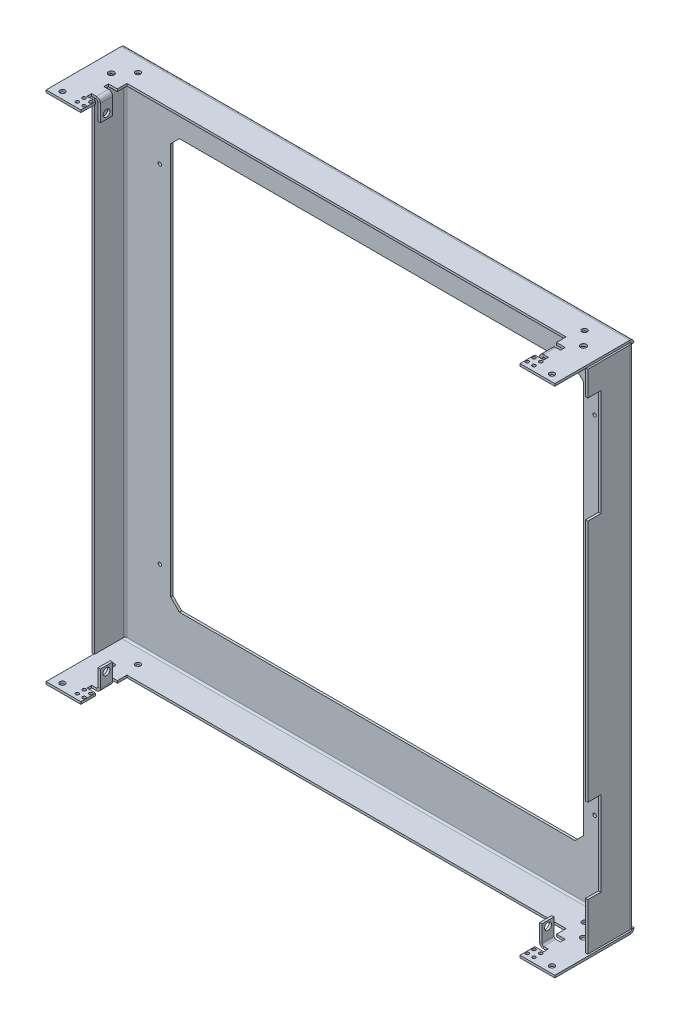
from build123d import *

# Parameters (mm, degrees)
SKETCH1_W                    = 585
SKETCH1_H                    = 592
BASE_FLANGE1_DEPTH           = 2.7
CUT_EXTRUDE1_REACH           = 834.284
CUT_EXTRUDE2_REACH           = 834.284
SKETCH7_R                    = 2
EDGE_FLANGE1_STRIP_W         = 14.8
EDGE_FLANGE1_STRIP_H         = 2.7
EDGE_FLANGE1_STRIP_CUT_DEPTH = 585
EDGE_FLANGE1_DEPTH           = 585
CUT_EXTRUDE3_REACH           = 838.95
SKETCH12_W                   = 505
SKETCH12_H                   = 53
CUT_EXTRUDE4_REACH           = 838.95
SKETCH13_R                   = 1.9
SKETCH13_R_2                 = 3
SKETCH13_R_3                 = 3.295
SKETCH13_W                   = 5
SKETCH13_H                   = 2.6
EDGE_FLANGE2_START           = 46.4
EDGE_FLANGE2_OUTLINE_W       = 10.1
EDGE_FLANGE2_OUTLINE_H       = 2.7
EDGE_FLANGE2_DEPTH           = 5.4
EDGE_FLANGE2_START_2         = 65.8
EDGE_FLANGE2_2_OUTLINE_W     = 10.1
EDGE_FLANGE2_2_OUTLINE_H     = 2.7
EDGE_FLANGE2_2_DEPTH         = 5.4
EDGE_FLANGE2_START_3         = 51.8
EDGE_FLANGE2_3_DEPTH         = 14
EDGE_FLANGE2_4_DEPTH         = 14
EDGE_FLANGE3_START           = 46.4
EDGE_FLANGE3_OUTLINE_W       = 10.1
EDGE_FLANGE3_OUTLINE_H       = 2.7
EDGE_FLANGE3_DEPTH           = 5.4
EDGE_FLANGE3_START_2         = 65.8
EDGE_FLANGE3_2_OUTLINE_W     = 10.1
EDGE_FLANGE3_2_OUTLINE_H     = 2.7
EDGE_FLANGE3_2_DEPTH         = 5.4
EDGE_FLANGE3_START_3         = 51.8
EDGE_FLANGE3_3_DEPTH         = 14
EDGE_FLANGE3_4_DEPTH         = 14
SKETCH18_R                   = 4
CUT_EXTRUDE6_DEPTH           = 810.497306975
EDGE_FLANGE4_START           = 46.4
EDGE_FLANGE4_OUTLINE_W       = 10.1
EDGE_FLANGE4_OUTLINE_H       = 2.7
EDGE_FLANGE4_DEPTH           = 5.4
EDGE_FLANGE4_START_2         = 65.8
EDGE_FLANGE4_2_OUTLINE_W     = 10.1
EDGE_FLANGE4_2_OUTLINE_H     = 2.7
EDGE_FLANGE4_2_DEPTH         = 5.4
EDGE_FLANGE4_START_3         = 51.8
EDGE_FLANGE4_3_DEPTH         = 14
EDGE_FLANGE4_4_DEPTH         = 14
CUT_EXTRUDE7_REACH           = 811.497
SKETCH25_R                   = 4
EDGE_FLANGE5_STRIP_W         = 14.8
EDGE_FLANGE5_STRIP_H         = 2.7
EDGE_FLANGE5_STRIP_CUT_DEPTH = 582.6
EDGE_FLANGE5_DEPTH           = 582.6
EDGE_FLANGE6_STRIP_W         = 14.8
EDGE_FLANGE6_STRIP_H         = 2.7
EDGE_FLANGE6_STRIP_CUT_DEPTH = 582.6
EDGE_FLANGE6_DEPTH           = 582.6
CUT_EXTRUDE8_REACH           = 838.95
SKETCH37_W                   = 15
SKETCH37_H                   = 122.57172438
SKETCH37_H_2                 = 97.043961851


# Read off the part's stored shape, not the designer's step: Edge-Flange2, Edge-Flange3, Edge-Flange4
# Sheet-metal steps are written as plain solids
with BuildPart() as part:
    # Sketch1 → Base-Flange1 (new body)
    with BuildSketch(Plane.XY):
        with Locations((292.5, 296)):
            Rectangle(SKETCH1_W, SKETCH1_H)
    extrude(amount=-BASE_FLANGE1_DEPTH)

    # Sketch6 → Cut-Extrude1 (cut, up to next)
    with BuildSketch(Plane.XY, mode=Mode.PRIVATE) as cut_extrude1_sk1:
        Polygon((520, 531.8), (65, 531.8), (55, 521.8), (55, 70.2), (65, 60.2), (520, 60.2), (530, 70.2), (530, 521.8), align=None)
    cut_extrude1_tool1 = extrude(cut_extrude1_sk1.sketch, amount=-CUT_EXTRUDE1_REACH, mode=Mode.PRIVATE) & part.part
    add(cut_extrude1_tool1.solids().sort_by_distance((292.5, 296, 0))[0], mode=Mode.SUBTRACT)

    # Sketch7 → Cut-Extrude2 (cut, up to next)
    with BuildSketch(Plane.XY, mode=Mode.PRIVATE) as cut_extrude2_sk1:
        with Locations((42.5, 495.3)):
            Circle(SKETCH7_R)
    cut_extrude2_tool1 = extrude(cut_extrude2_sk1.sketch, amount=-CUT_EXTRUDE2_REACH, mode=Mode.PRIVATE) & part.part
    # Sketch7 → Cut-Extrude2 (cut, up to next)
    with BuildSketch(Plane.XY, mode=Mode.PRIVATE) as cut_extrude2_sk2:
        with Locations((542.5, 495.3)):
            Circle(SKETCH7_R)
    cut_extrude2_tool2 = extrude(cut_extrude2_sk2.sketch, amount=-CUT_EXTRUDE2_REACH, mode=Mode.PRIVATE) & part.part
    # Sketch7 → Cut-Extrude2 (cut, up to next)
    with BuildSketch(Plane.XY, mode=Mode.PRIVATE) as cut_extrude2_sk3:
        with Locations((42.5, 96.7)):
            Circle(SKETCH7_R)
    cut_extrude2_tool3 = extrude(cut_extrude2_sk3.sketch, amount=-CUT_EXTRUDE2_REACH, mode=Mode.PRIVATE) & part.part
    # Sketch7 → Cut-Extrude2 (cut, up to next)
    with BuildSketch(Plane.XY, mode=Mode.PRIVATE) as cut_extrude2_sk4:
        with Locations((542.5, 96.7)):
            Circle(SKETCH7_R)
    cut_extrude2_tool4 = extrude(cut_extrude2_sk4.sketch, amount=-CUT_EXTRUDE2_REACH, mode=Mode.PRIVATE) & part.part
    add(cut_extrude2_tool1.solids().sort_by_distance((42.5, 495.3, 0))[0], mode=Mode.SUBTRACT)
    add(cut_extrude2_tool2.solids().sort_by_distance((542.5, 495.3, 0))[0], mode=Mode.SUBTRACT)
    add(cut_extrude2_tool3.solids().sort_by_distance((42.5, 96.7, 0))[0], mode=Mode.SUBTRACT)
    add(cut_extrude2_tool4.solids().sort_by_distance((542.5, 96.7, 0))[0], mode=Mode.SUBTRACT)

    # Edge-Flange1 strip (across the edge) → Edge-Flange1 strip cut (cut)
    with BuildSketch(Plane.YZ):
        with Locations((-2.7, -1.35)):
            Rectangle(EDGE_FLANGE1_STRIP_W, EDGE_FLANGE1_STRIP_H)
    edge_flange1_strip_cut = extrude(amount=EDGE_FLANGE1_STRIP_CUT_DEPTH, mode=Mode.SUBTRACT)

    # Edge-Flange1 section (across the edge) → Edge-Flange1 (add)
    with BuildSketch(Plane.YZ):
        with BuildLine():
            Line((0, 2), (0, 88.3))
            Line((0, 88.3), (2.7, 88.3))
            Line((2.7, 88.3), (2.7, 2))
            ThreePointArc((2.7, 2), (3.285786438, 0.585786438), (4.7, 0))
            Line((4.7, 0), (4.7, -2.7))
            ThreePointArc((4.7, -2.7), (1.376598128, -1.323401872), (0, 2))
        make_face()
    edge_flange1 = extrude(amount=EDGE_FLANGE1_DEPTH)

    # Sketch12 → Cut-Extrude3 (cut, up to next)
    with BuildSketch(Plane.XZ, mode=Mode.PRIVATE) as cut_extrude3_sk1:
        with Locations((292.5, 61.8)):
            Rectangle(SKETCH12_W, SKETCH12_H)
    cut_extrude3_tool1 = extrude(cut_extrude3_sk1.sketch, amount=-CUT_EXTRUDE3_REACH, mode=Mode.PRIVATE) & part.part
    cut_extrude3 = cut_extrude3_tool1.solids().sort_by_distance((292.5, 0, 61.8))[0]
    add(cut_extrude3, mode=Mode.SUBTRACT)

    # Sketch13 → Cut-Extrude4 (cut, up to next)
    with BuildSketch(Plane.XZ, mode=Mode.PRIVATE) as cut_extrude4_sk1:
        with Locations(Location((555.05, 74.5, 0), (0, 0, 270))):
            Circle(SKETCH13_R)
    cut_extrude4_tool1 = extrude(cut_extrude4_sk1.sketch, amount=-CUT_EXTRUDE4_REACH, mode=Mode.PRIVATE) & part.part
    # Sketch13 → Cut-Extrude4 (cut, up to next)
    with BuildSketch(Plane.XZ, mode=Mode.PRIVATE) as cut_extrude4_sk2:
        with Locations(Location((547.25, 74.5, 0), (0, 0, 270))):
            Circle(SKETCH13_R)
    cut_extrude4_tool2 = extrude(cut_extrude4_sk2.sketch, amount=-CUT_EXTRUDE4_REACH, mode=Mode.PRIVATE) & part.part
    # Sketch13 → Cut-Extrude4 (cut, up to next)
    with BuildSketch(Plane.XZ, mode=Mode.PRIVATE) as cut_extrude4_sk3:
        with Locations(Location((555.05, 82.3, 0), (0, 0, 270))):
            Circle(SKETCH13_R)
    cut_extrude4_tool3 = extrude(cut_extrude4_sk3.sketch, amount=-CUT_EXTRUDE4_REACH, mode=Mode.PRIVATE) & part.part
    # Sketch13 → Cut-Extrude4 (cut, up to next)
    with BuildSketch(Plane.XZ, mode=Mode.PRIVATE) as cut_extrude4_sk4:
        with Locations(Location((547.25, 82.3, 0), (0, 0, 270))):
            Circle(SKETCH13_R)
    cut_extrude4_tool4 = extrude(cut_extrude4_sk4.sketch, amount=-CUT_EXTRUDE4_REACH, mode=Mode.PRIVATE) & part.part
    # Sketch13 → Cut-Extrude4 (cut, up to next)
    with BuildSketch(Plane.XZ, mode=Mode.PRIVATE) as cut_extrude4_sk5:
        with Locations(Location((574, 80.5, 0), (0, 0, 270))):
            Circle(SKETCH13_R_2)
    cut_extrude4_tool5 = extrude(cut_extrude4_sk5.sketch, amount=-CUT_EXTRUDE4_REACH, mode=Mode.PRIVATE) & part.part
    # Sketch13 → Cut-Extrude4 (cut, up to next)
    with BuildSketch(Plane.XZ, mode=Mode.PRIVATE) as cut_extrude4_sk6:
        with Locations(Location((564, 34.3, 0), (0, 0, 270))):
            Circle(SKETCH13_R_3)
    cut_extrude4_tool6 = extrude(cut_extrude4_sk6.sketch, amount=-CUT_EXTRUDE4_REACH, mode=Mode.PRIVATE) & part.part
    # Sketch13 → Cut-Extrude4 (cut, up to next)
    with BuildSketch(Plane.XZ, mode=Mode.PRIVATE) as cut_extrude4_sk7:
        with Locations(Location((549.3, 18.3, 0), (0, 0, 270))):
            Circle(SKETCH13_R_2)
    cut_extrude4_tool7 = extrude(cut_extrude4_sk7.sketch, amount=-CUT_EXTRUDE4_REACH, mode=Mode.PRIVATE) & part.part
    # Sketch13 → Cut-Extrude4 (cut, up to next)
    with BuildSketch(Plane.XZ, mode=Mode.PRIVATE) as cut_extrude4_sk8:
        with Locations(Location((35.7, 18.3, 0), (0, 0, 90))):
            Circle(SKETCH13_R_2)
    cut_extrude4_tool8 = extrude(cut_extrude4_sk8.sketch, amount=-CUT_EXTRUDE4_REACH, mode=Mode.PRIVATE) & part.part
    # Sketch13 → Cut-Extrude4 (cut, up to next)
    with BuildSketch(Plane.XZ, mode=Mode.PRIVATE) as cut_extrude4_sk9:
        with Locations(Location((21, 34.3, 0), (0, 0, 90))):
            Circle(SKETCH13_R_3)
    cut_extrude4_tool9 = extrude(cut_extrude4_sk9.sketch, amount=-CUT_EXTRUDE4_REACH, mode=Mode.PRIVATE) & part.part
    # Sketch13 → Cut-Extrude4 (cut, up to next)
    with BuildSketch(Plane.XZ, mode=Mode.PRIVATE) as cut_extrude4_sk10:
        with Locations(Location((11, 80.5, 0), (0, 0, 90))):
            Circle(SKETCH13_R_2)
    cut_extrude4_tool10 = extrude(cut_extrude4_sk10.sketch, amount=-CUT_EXTRUDE4_REACH, mode=Mode.PRIVATE) & part.part
    # Sketch13 → Cut-Extrude4 (cut, up to next)
    with BuildSketch(Plane.XZ, mode=Mode.PRIVATE) as cut_extrude4_sk11:
        with Locations(Location((37.75, 82.3, 0), (0, 0, 90))):
            Circle(SKETCH13_R)
    cut_extrude4_tool11 = extrude(cut_extrude4_sk11.sketch, amount=-CUT_EXTRUDE4_REACH, mode=Mode.PRIVATE) & part.part
    # Sketch13 → Cut-Extrude4 (cut, up to next)
    with BuildSketch(Plane.XZ, mode=Mode.PRIVATE) as cut_extrude4_sk12:
        with Locations(Location((29.95, 82.3, 0), (0, 0, 90))):
            Circle(SKETCH13_R)
    cut_extrude4_tool12 = extrude(cut_extrude4_sk12.sketch, amount=-CUT_EXTRUDE4_REACH, mode=Mode.PRIVATE) & part.part
    # Sketch13 → Cut-Extrude4 (cut, up to next)
    with BuildSketch(Plane.XZ, mode=Mode.PRIVATE) as cut_extrude4_sk13:
        with Locations(Location((37.75, 74.5, 0), (0, 0, 90))):
            Circle(SKETCH13_R)
    cut_extrude4_tool13 = extrude(cut_extrude4_sk13.sketch, amount=-CUT_EXTRUDE4_REACH, mode=Mode.PRIVATE) & part.part
    # Sketch13 → Cut-Extrude4 (cut, up to next)
    with BuildSketch(Plane.XZ, mode=Mode.PRIVATE) as cut_extrude4_sk14:
        with Locations(Location((29.95, 74.5, 0), (0, 0, 90))):
            Circle(SKETCH13_R)
    cut_extrude4_tool14 = extrude(cut_extrude4_sk14.sketch, amount=-CUT_EXTRUDE4_REACH, mode=Mode.PRIVATE) & part.part
    # Sketch13 → Cut-Extrude4 (cut, up to next)
    with BuildSketch(Plane.XZ, mode=Mode.PRIVATE) as cut_extrude4_sk15:
        with Locations((547.5, 50.5)):
            Rectangle(SKETCH13_W, SKETCH13_H)
    cut_extrude4_tool15 = extrude(cut_extrude4_sk15.sketch, amount=-CUT_EXTRUDE4_REACH, mode=Mode.PRIVATE) & part.part
    # Sketch13 → Cut-Extrude4 (cut, up to next)
    with BuildSketch(Plane.XZ, mode=Mode.PRIVATE) as cut_extrude4_sk16:
        with Locations((547.5, 67.1)):
            Rectangle(SKETCH13_W, SKETCH13_H)
    cut_extrude4_tool16 = extrude(cut_extrude4_sk16.sketch, amount=-CUT_EXTRUDE4_REACH, mode=Mode.PRIVATE) & part.part
    # Sketch13 → Cut-Extrude4 (cut, up to next)
    with BuildSketch(Plane.XZ, mode=Mode.PRIVATE) as cut_extrude4_sk17:
        with Locations((37.5, 50.5)):
            Rectangle(SKETCH13_W, SKETCH13_H)
    cut_extrude4_tool17 = extrude(cut_extrude4_sk17.sketch, amount=-CUT_EXTRUDE4_REACH, mode=Mode.PRIVATE) & part.part
    # Sketch13 → Cut-Extrude4 (cut, up to next)
    with BuildSketch(Plane.XZ, mode=Mode.PRIVATE) as cut_extrude4_sk18:
        with Locations((37.5, 67.1)):
            Rectangle(SKETCH13_W, SKETCH13_H)
    cut_extrude4_tool18 = extrude(cut_extrude4_sk18.sketch, amount=-CUT_EXTRUDE4_REACH, mode=Mode.PRIVATE) & part.part
    cut_extrude4_1 = cut_extrude4_tool1.solids().sort_by_distance((555.05, 0, 74.5))[0]
    add(cut_extrude4_1, mode=Mode.SUBTRACT)
    cut_extrude4_2 = cut_extrude4_tool2.solids().sort_by_distance((547.25, 0, 74.5))[0]
    add(cut_extrude4_2, mode=Mode.SUBTRACT)
    cut_extrude4_3 = cut_extrude4_tool3.solids().sort_by_distance((555.05, 0, 82.3))[0]
    add(cut_extrude4_3, mode=Mode.SUBTRACT)
    cut_extrude4_4 = cut_extrude4_tool4.solids().sort_by_distance((547.25, 0, 82.3))[0]
    add(cut_extrude4_4, mode=Mode.SUBTRACT)
    cut_extrude4_5 = cut_extrude4_tool5.solids().sort_by_distance((574, 0, 80.5))[0]
    add(cut_extrude4_5, mode=Mode.SUBTRACT)
    cut_extrude4_6 = cut_extrude4_tool6.solids().sort_by_distance((564, 0, 34.3))[0]
    add(cut_extrude4_6, mode=Mode.SUBTRACT)
    cut_extrude4_7 = cut_extrude4_tool7.solids().sort_by_distance((549.3, 0, 18.3))[0]
    add(cut_extrude4_7, mode=Mode.SUBTRACT)
    cut_extrude4_8 = cut_extrude4_tool8.solids().sort_by_distance((35.7, 0, 18.3))[0]
    add(cut_extrude4_8, mode=Mode.SUBTRACT)
    cut_extrude4_9 = cut_extrude4_tool9.solids().sort_by_distance((21, 0, 34.3))[0]
    add(cut_extrude4_9, mode=Mode.SUBTRACT)
    cut_extrude4_10 = cut_extrude4_tool10.solids().sort_by_distance((11, 0, 80.5))[0]
    add(cut_extrude4_10, mode=Mode.SUBTRACT)
    cut_extrude4_11 = cut_extrude4_tool11.solids().sort_by_distance((37.75, 0, 82.3))[0]
    add(cut_extrude4_11, mode=Mode.SUBTRACT)
    cut_extrude4_12 = cut_extrude4_tool12.solids().sort_by_distance((29.95, 0, 82.3))[0]
    add(cut_extrude4_12, mode=Mode.SUBTRACT)
    cut_extrude4_13 = cut_extrude4_tool13.solids().sort_by_distance((37.75, 0, 74.5))[0]
    add(cut_extrude4_13, mode=Mode.SUBTRACT)
    cut_extrude4_14 = cut_extrude4_tool14.solids().sort_by_distance((29.95, 0, 74.5))[0]
    add(cut_extrude4_14, mode=Mode.SUBTRACT)
    cut_extrude4_15 = cut_extrude4_tool15.solids().sort_by_distance((547.5, 0, 50.5))[0]
    add(cut_extrude4_15, mode=Mode.SUBTRACT)
    cut_extrude4_16 = cut_extrude4_tool16.solids().sort_by_distance((547.5, 0, 67.1))[0]
    add(cut_extrude4_16, mode=Mode.SUBTRACT)
    cut_extrude4_17 = cut_extrude4_tool17.solids().sort_by_distance((37.5, 0, 50.5))[0]
    add(cut_extrude4_17, mode=Mode.SUBTRACT)
    cut_extrude4_18 = cut_extrude4_tool18.solids().sort_by_distance((37.5, 0, 67.1))[0]
    add(cut_extrude4_18, mode=Mode.SUBTRACT)
    cut_extrude4 = cut_extrude4_1 + cut_extrude4_2 + cut_extrude4_3 + cut_extrude4_4 + cut_extrude4_5 + cut_extrude4_6 + cut_extrude4_7 + cut_extrude4_8 + cut_extrude4_9 + cut_extrude4_10 + cut_extrude4_11 + cut_extrude4_12 + cut_extrude4_13 + cut_extrude4_14 + cut_extrude4_15 + cut_extrude4_16 + cut_extrude4_17 + cut_extrude4_18  # Cut-Extrude4 as one shape, for the pattern or mirror that repeats it

    # Edge-Flange2 outline → Edge-Flange2 (cut)
    with BuildSketch(Plane.XY.offset(EDGE_FLANGE2_START)):
        with Locations((550.05, 1.35)):
            Rectangle(EDGE_FLANGE2_OUTLINE_W, EDGE_FLANGE2_OUTLINE_H)
    extrude(amount=EDGE_FLANGE2_DEPTH, mode=Mode.SUBTRACT)

    # Edge-Flange2 2 outline → Edge-Flange2 2 (cut)
    with BuildSketch(Plane.XY.offset(EDGE_FLANGE2_START_2)):
        with Locations((550.05, 1.35)):
            Rectangle(EDGE_FLANGE2_2_OUTLINE_W, EDGE_FLANGE2_2_OUTLINE_H)
    extrude(amount=EDGE_FLANGE2_2_DEPTH, mode=Mode.SUBTRACT)

    # Edge-Flange2 3 outline → Edge-Flange2 3 (cut)
    with BuildSketch(Plane.XY.offset(EDGE_FLANGE2_START_3)):
        with BuildLine():
            ThreePointArc((549.7, 0), (547.181071656, 0.732003024), (545.446765936, 2.7))
            Line((545.446765936, 2.7), (545, 2.7))
            Line((545, 2.7), (545, 0))
            Line((545, 0), (549.7, 0))
        make_face()
    extrude(amount=EDGE_FLANGE2_3_DEPTH, mode=Mode.SUBTRACT)

    # Edge-Flange2 4 outline → Edge-Flange2 4 (add)
    with BuildSketch(Plane.XY.offset(EDGE_FLANGE2_START_3)):
        with BuildLine():
            Line((547.7, 24), (545, 24))
            Line((545, 24), (545, 4.7))
            ThreePointArc((545, 4.7), (545.113051117, 3.675353744), (545.446765936, 2.7))
            Line((545.446765936, 2.7), (549.7, 2.7))
            ThreePointArc((549.7, 2.7), (548.285786438, 3.285786438), (547.7, 4.7))
            Line((547.7, 4.7), (547.7, 24))
        make_face()
    extrude(amount=EDGE_FLANGE2_4_DEPTH)

    # Edge-Flange3 outline → Edge-Flange3 (cut)
    with BuildSketch(Plane.XY.offset(EDGE_FLANGE3_START)):
        with Locations((34.95, 1.35)):
            Rectangle(EDGE_FLANGE3_OUTLINE_W, EDGE_FLANGE3_OUTLINE_H)
    edge_flange3 = extrude(amount=EDGE_FLANGE3_DEPTH, mode=Mode.SUBTRACT)

    # Edge-Flange3 2 outline → Edge-Flange3 2 (cut)
    with BuildSketch(Plane.XY.offset(EDGE_FLANGE3_START_2)):
        with Locations((34.95, 1.35)):
            Rectangle(EDGE_FLANGE3_2_OUTLINE_W, EDGE_FLANGE3_2_OUTLINE_H)
    edge_flange3_2 = extrude(amount=EDGE_FLANGE3_2_DEPTH, mode=Mode.SUBTRACT)

    # Edge-Flange3 3 outline → Edge-Flange3 3 (cut)
    with BuildSketch(Plane.XY.offset(EDGE_FLANGE3_START_3)):
        with BuildLine():
            Line((40, 2.7), (39.553234064, 2.7))
            ThreePointArc((39.553234064, 2.7), (37.818928344, 0.732003024), (35.3, 0))
            Line((35.3, 0), (40, 0))
            Line((40, 0), (40, 2.7))
        make_face()
    edge_flange3_3 = extrude(amount=EDGE_FLANGE3_3_DEPTH, mode=Mode.SUBTRACT)

    # Edge-Flange3 4 outline → Edge-Flange3 4 (add)
    with BuildSketch(Plane.XY.offset(EDGE_FLANGE3_START_3)):
        with BuildLine():
            Line((40, 4.7), (40, 24))
            Line((40, 24), (37.3, 24))
            Line((37.3, 24), (37.3, 4.7))
            ThreePointArc((37.3, 4.7), (36.714213562, 3.285786438), (35.3, 2.7))
            Line((35.3, 2.7), (39.553234064, 2.7))
            ThreePointArc((39.553234064, 2.7), (39.886948883, 3.675353744), (40, 4.7))
        make_face()
    edge_flange3_4 = extrude(amount=EDGE_FLANGE3_4_DEPTH)

    # Sketch18 → Cut-Extrude6 (cut, symmetric)
    with BuildSketch(Plane.ZY.offset(-545)):
        with Locations(Location((58.8, 18, 0), (0, 0, 270))):
            Circle(SKETCH18_R)
    cut_extrude6 = extrude(amount=CUT_EXTRUDE6_DEPTH, both=True, mode=Mode.SUBTRACT)

    # Mirror1: Edge-Flange1 strip cut, Edge-Flange1, Cut-Extrude3, Cut-Extrude4, Edge-Flange3, Edge-Flange3 2, Edge-Flange3 3, Edge-Flange3 4, Cut-Extrude6 across plane
    add(edge_flange1_strip_cut.mirror(Plane.ZX.offset(296)), mode=Mode.SUBTRACT)
    add(edge_flange1.mirror(Plane.ZX.offset(296)))
    add(cut_extrude3.mirror(Plane.ZX.offset(296)), mode=Mode.SUBTRACT)
    add(cut_extrude4.mirror(Plane.ZX.offset(296)), mode=Mode.SUBTRACT)
    add(edge_flange3.mirror(Plane.ZX.offset(296)), mode=Mode.SUBTRACT)
    add(edge_flange3_2.mirror(Plane.ZX.offset(296)), mode=Mode.SUBTRACT)
    add(edge_flange3_3.mirror(Plane.ZX.offset(296)), mode=Mode.SUBTRACT)
    add(edge_flange3_4.mirror(Plane.ZX.offset(296)))
    add(cut_extrude6.mirror(Plane.ZX.offset(296)), mode=Mode.SUBTRACT)

    # Edge-Flange4 outline → Edge-Flange4 (cut)
    with BuildSketch(Plane.XY.offset(EDGE_FLANGE4_START)):
        with Locations((550.05, 590.65)):
            Rectangle(EDGE_FLANGE4_OUTLINE_W, EDGE_FLANGE4_OUTLINE_H)
    extrude(amount=EDGE_FLANGE4_DEPTH, mode=Mode.SUBTRACT)

    # Edge-Flange4 2 outline → Edge-Flange4 2 (cut)
    with BuildSketch(Plane.XY.offset(EDGE_FLANGE4_START_2)):
        with Locations((550.05, 590.65)):
            Rectangle(EDGE_FLANGE4_2_OUTLINE_W, EDGE_FLANGE4_2_OUTLINE_H)
    extrude(amount=EDGE_FLANGE4_2_DEPTH, mode=Mode.SUBTRACT)

    # Edge-Flange4 3 outline → Edge-Flange4 3 (cut)
    with BuildSketch(Plane.XY.offset(EDGE_FLANGE4_START_3)):
        with BuildLine():
            Line((545, 589.3), (545.446765936, 589.3))
            ThreePointArc((545.446765936, 589.3), (547.181071656, 591.267996976), (549.7, 592))
            Line((549.7, 592), (545, 592))
            Line((545, 592), (545, 589.3))
        make_face()
    extrude(amount=EDGE_FLANGE4_3_DEPTH, mode=Mode.SUBTRACT)

    # Edge-Flange4 4 outline → Edge-Flange4 4 (add)
    with BuildSketch(Plane.XY.offset(EDGE_FLANGE4_START_3)):
        with BuildLine():
            ThreePointArc((545.446765936, 589.3), (545.113051117, 588.324646256), (545, 587.3))
            Line((545, 587.3), (545, 568))
            Line((545, 568), (547.7, 568))
            Line((547.7, 568), (547.7, 587.3))
            ThreePointArc((547.7, 587.3), (548.285786438, 588.714213562), (549.7, 589.3))
            Line((549.7, 589.3), (545.446765936, 589.3))
        make_face()
    extrude(amount=EDGE_FLANGE4_4_DEPTH)

    # Sketch25 → Cut-Extrude7 (cut, up to next)
    with BuildSketch(Plane.ZY.offset(-545), mode=Mode.PRIVATE) as cut_extrude7_sk1:
        with Locations(Location((58.8, 574, 0), (0, 0, 270))):
            Circle(SKETCH25_R)
    cut_extrude7_tool1 = extrude(cut_extrude7_sk1.sketch, amount=-CUT_EXTRUDE7_REACH, mode=Mode.PRIVATE) & part.part
    add(cut_extrude7_tool1.solids().sort_by_distance((545, 574, 58.8))[0], mode=Mode.SUBTRACT)

    # Edge-Flange5 strip (across the edge) → Edge-Flange5 strip cut (cut)
    with BuildSketch(Plane.XZ.offset(-587.3)):
        with Locations((-2.7, -1.35)):
            Rectangle(EDGE_FLANGE5_STRIP_W, EDGE_FLANGE5_STRIP_H)
    extrude(amount=EDGE_FLANGE5_STRIP_CUT_DEPTH, mode=Mode.SUBTRACT)

    # Edge-Flange5 section (across the edge) → Edge-Flange5 (add)
    with BuildSketch(Plane.XZ.offset(-587.3)):
        with BuildLine():
            Line((0, 2), (0, 35.3))
            Line((0, 35.3), (2.7, 35.3))
            Line((2.7, 35.3), (2.7, 2))
            ThreePointArc((2.7, 2), (3.285786438, 0.585786438), (4.7, 0))
            Line((4.7, 0), (4.7, -2.7))
            ThreePointArc((4.7, -2.7), (1.376598128, -1.323401872), (0, 2))
        make_face()
    extrude(amount=EDGE_FLANGE5_DEPTH)

    # Edge-Flange6 strip (across the edge) → Edge-Flange6 strip cut (cut)
    with BuildSketch(Plane(origin=(585, 4.7, 0), x_dir=(-1, 0, 0), z_dir=(0, 1, 0))):
        with Locations((-2.7, -1.35)):
            Rectangle(EDGE_FLANGE6_STRIP_W, EDGE_FLANGE6_STRIP_H)
    extrude(amount=EDGE_FLANGE6_STRIP_CUT_DEPTH, mode=Mode.SUBTRACT)

    # Edge-Flange6 section (across the edge) → Edge-Flange6 (add)
    with BuildSketch(Plane(origin=(585, 4.7, 0), x_dir=(-1, 0, 0), z_dir=(0, 1, 0))):
        with BuildLine():
            Line((0, 2), (0, 50.3))
            Line((0, 50.3), (2.7, 50.3))
            Line((2.7, 50.3), (2.7, 2))
            ThreePointArc((2.7, 2), (3.285786438, 0.585786438), (4.7, 0))
            Line((4.7, 0), (4.7, -2.7))
            ThreePointArc((4.7, -2.7), (1.376598128, -1.323401872), (0, 2))
        make_face()
    extrude(amount=EDGE_FLANGE6_DEPTH)

    # Sketch37 → Cut-Extrude8 (cut, up to next)
    with BuildSketch(Plane(origin=(585, 0, 0), x_dir=(0, 0, -1), z_dir=(1, 0, 0)), mode=Mode.PRIVATE) as cut_extrude8_sk1:
        with Locations((-42.8, 497.28586219)):
            Rectangle(SKETCH37_W, SKETCH37_H)
    cut_extrude8_tool1 = extrude(cut_extrude8_sk1.sketch, amount=-CUT_EXTRUDE8_REACH, mode=Mode.PRIVATE) & part.part
    # Sketch37 → Cut-Extrude8 (cut, up to next)
    with BuildSketch(Plane(origin=(585, 0, 0), x_dir=(0, 0, -1), z_dir=(1, 0, 0)), mode=Mode.PRIVATE) as cut_extrude8_sk2:
        with Locations((-42.8, 107.478019074)):
            Rectangle(SKETCH37_W, SKETCH37_H_2)
    cut_extrude8_tool2 = extrude(cut_extrude8_sk2.sketch, amount=-CUT_EXTRUDE8_REACH, mode=Mode.PRIVATE) & part.part
    add(cut_extrude8_tool1.solids().sort_by_distance((585, 497.285862, 42.8))[0], mode=Mode.SUBTRACT)
    add(cut_extrude8_tool2.solids().sort_by_distance((585, 107.478019, 42.8))[0], mode=Mode.SUBTRACT)


solid = part.part
